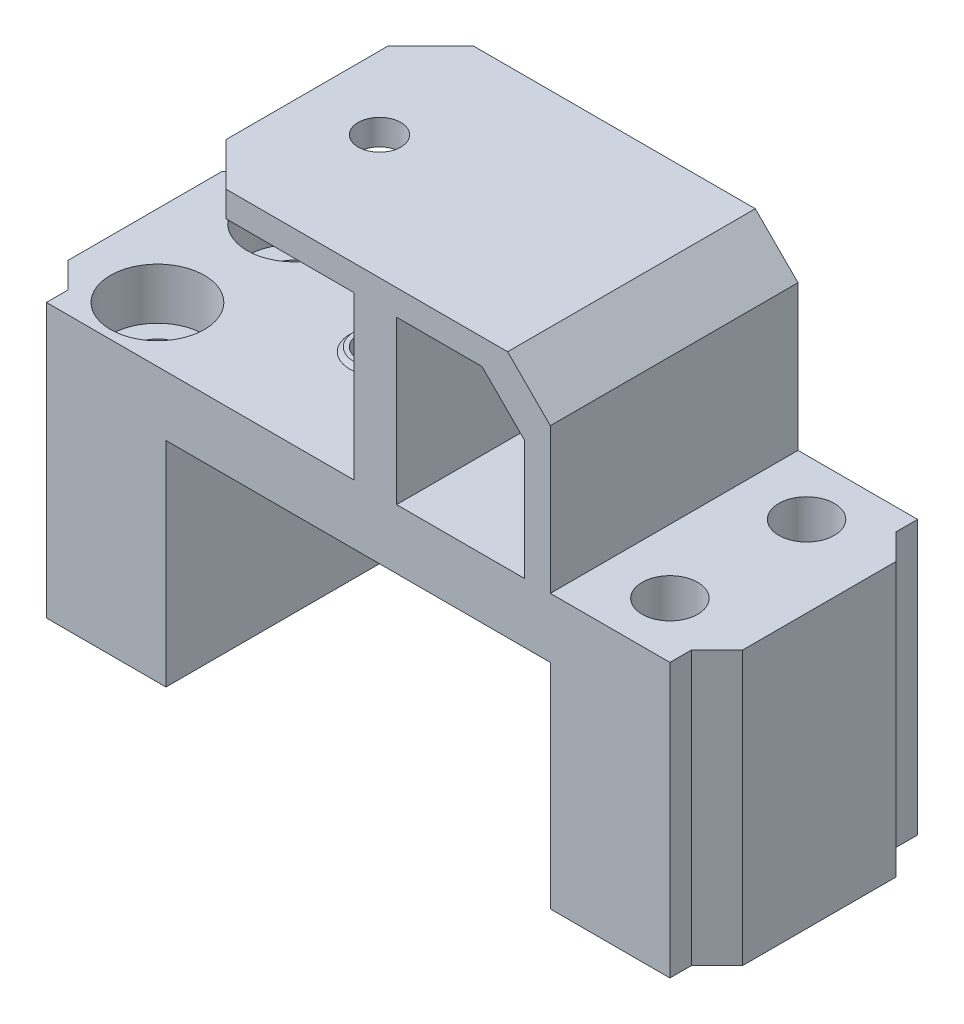
from build123d import *
from build123d.topology import SkipClean

# Parameters (mm, degrees)
SKETCH1_W               = 44.05184454
SKETCH1_H               = 18
BOSS_EXTRUDE1_DEPTH     = 1.5
SKETCH2_W               = 3
SKETCH2_H               = 18
BOSS_EXTRUDE2_DEPTH     = 13
SKETCH3_W               = 29
SKETCH3_H               = 3
BOSS_EXTRUDE3_DEPTH     = 14
CHAMFER1_SIZE           = 3
SKETCH4_R               = 3.25
CUT_EXTRUDE1_DEPTH      = 14
BOSS_EXTRUDE4_START     = 20
SKETCH5_R               = 3.25
BOSS_EXTRUDE4_DEPTH     = 20
BOSS_EXTRUDE5_START     = 7
SKETCH6_R               = 3.25
SKETCH6_W               = 22.5
SKETCH6_H               = 29
BOSS_EXTRUDE5_DEPTH     = 7
SKETCH8_R               = 3.25
BOSS_EXTRUDE6_DEPTH     = 23
BOSS_EXTRUDE8_DEPTH     = 29
SKETCH9_R               = 38.719812757
CUT_EXTRUDE2_DEPTH      = 11.5
CUT_EXTRUDE3_DEPTH      = 79.971513852
CUT_EXTRUDE3_DEPTH_BACK = 79.971513852
SKETCH10_R              = 2.5
CUT_EXTRUDE4_DEPTH      = 3
SKETCH12_R              = 3
SKETCH12_R_2            = 2.5
BOSS_EXTRUDE7_DEPTH     = 0.5
CHAMFER2_SIZE           = 0.5
SKETCH17_R              = 5.5
CUT_EXTRUDE5_DEPTH      = 6
CHAMFER3_SIZE           = 5
BOSS_EXTRUDE9_DEPTH     = 29
CHAMFER4_SIZE           = 5
SKETCH20_R              = 3.25
BOSS_EXTRUDE10_DEPTH    = 2


with BuildPart() as part:
    # Sketch1 → Boss-Extrude1 (new body)
    with BuildSketch(Plane(origin=(0, 0, 0), x_dir=(1, 0, 0), z_dir=(0, 1, 0))):
        with Locations((88.52592227, 8)):
            Rectangle(SKETCH1_W, SKETCH1_H)
        with BuildLine():
            Line((99.736944586, 5.75), (95.736944586, 5.75))
            ThreePointArc((95.736944586, 5.75), (93.486944586, 8), (95.736944586, 10.25))
            Line((95.736944586, 10.25), (99.736944586, 10.25))
            ThreePointArc((99.736944586, 10.25), (101.986944586, 8), (99.736944586, 5.75))
        make_face(mode=Mode.SUBTRACT)
    extrude(amount=BOSS_EXTRUDE1_DEPTH)

    # Sketch2 → Boss-Extrude2 (add)
    with BuildSketch(Plane(origin=(0, 1.5, 0), x_dir=(1, 0, 0), z_dir=(0, 1, 0))):
        with Locations((68, 8)):
            Rectangle(SKETCH2_W, SKETCH2_H)
    extrude(amount=BOSS_EXTRUDE2_DEPTH)

    # Sketch3 → Boss-Extrude3 (add)
    with BuildSketch(Plane.ZY.offset(-66.5)):
        with Locations((-8, 13)):
            Rectangle(SKETCH3_W, SKETCH3_H)
    extrude(amount=BOSS_EXTRUDE3_DEPTH)

    # Chamfer1
    chamfer1_edges = [part.edges().sort_by_distance(p)[0] for p in [
        (66.5, 13, 1),
        (66.5, 13, -17),
    ]]
    chamfer(chamfer1_edges, length=CHAMFER1_SIZE - 0.0001)  # a hair under: the kernel refuses the full size

    # Sketch4 → Cut-Extrude1 (cut)
    with BuildSketch(Plane(origin=(0, 14.5, 0), x_dir=(1, 0, 0), z_dir=(0, 1, 0))):
        with Locations(Location((60, 16, 0), (0, 0, 270))):
            Circle(SKETCH4_R)
        with Locations(Location((60, 0, 0), (0, 0, 270))):
            Circle(SKETCH4_R)
    extrude(amount=-CUT_EXTRUDE1_DEPTH, mode=Mode.SUBTRACT)

    # Sketch5 → Boss-Extrude4 (add)
    with SkipClean():  # the faces are left unmerged after this step: merging them gives an invalid solid
        with BuildSketch(Plane(origin=(0, 14.5, 0), x_dir=(1, 0, 0), z_dir=(0, 1, 0)).offset(BOSS_EXTRUDE4_START)):
            Polygon((69.5, -1), (69.5, 17), (66.5, 20), (66.5, 22.5), (52.5, 22.5), (52.5, -6.5), (66.5, -6.5), (66.5, -4), align=None)
            with Locations(Location((60, 16, 0), (0, 0, 270))):
                Circle(SKETCH5_R, mode=Mode.SUBTRACT)
            with Locations(Location((60, 0, 0), (0, 0, 270))):
                Circle(SKETCH5_R, mode=Mode.SUBTRACT)
        extrude(amount=-BOSS_EXTRUDE4_DEPTH)

    # Sketch6 → Boss-Extrude5 (add)
    # profile 1 of 3: a face of its own
    with BuildSketch(Plane(origin=(0, 34.5, 0), x_dir=(1, 0, 0), z_dir=(0, 1, 0)).offset(BOSS_EXTRUDE5_START)):
        Polygon((30, -6.5), (30, 22.5), (7.5, 22.5), (-6.5, 22.5), (-6.5, 20), (-9.5, 17), (-9.5, -1), (-6.5, -4), (-6.5, -6.5), (7.5, -6.5), align=None)
        with Locations(Location((0, 0, 0), (0, 0, 90))):
            Circle(SKETCH6_R, mode=Mode.SUBTRACT)
        with Locations(Location((0, 16, 0), (0, 0, 90))):
            Circle(SKETCH6_R, mode=Mode.SUBTRACT)
    # profile 2 of 3: a face of its own
    with BuildSketch(Plane(origin=(0, 34.5, 0), x_dir=(1, 0, 0), z_dir=(0, 1, 0)).offset(BOSS_EXTRUDE5_START)):
        with Locations((41.25, 8)):
            Rectangle(SKETCH6_W, SKETCH6_H)
    # profile 3 of 3: a face of its own
    with BuildSketch(Plane(origin=(0, 34.5, 0), x_dir=(1, 0, 0), z_dir=(0, 1, 0)).offset(BOSS_EXTRUDE5_START)):
        Polygon((66.5, -6.5), (66.5, -4), (69.5, -1), (69.5, 17), (66.5, 20), (66.5, 22.5), (52.5, 22.5), (52.5, -6.5), align=None)
        with Locations(Location((60, 0, 0), (0, 0, 270))):
            Circle(SKETCH6_R, mode=Mode.SUBTRACT)
        with Locations(Location((60, 16, 0), (0, 0, 270))):
            Circle(SKETCH6_R, mode=Mode.SUBTRACT)
    extrude(amount=-BOSS_EXTRUDE5_DEPTH)

    # Sketch8 → Boss-Extrude6 (add)
    with BuildSketch(Plane.XZ.offset(-34.5)):
        Polygon((7.5, -22.5), (7.5, 6.5), (-6.5, 6.5), (-6.5, 4), (-9.5, 1), (-9.5, -17), (-6.5, -20), (-6.5, -22.5), align=None)
        with Locations(Location((0, -16, 0), (0, 0, 270))):
            Circle(SKETCH8_R, mode=Mode.SUBTRACT)
        with Locations(Location((0, 0, 0), (0, 0, 270))):
            Circle(SKETCH8_R, mode=Mode.SUBTRACT)
    extrude(amount=BOSS_EXTRUDE6_DEPTH)

    # Sketch18 → Boss-Extrude8 (add)
    with BuildSketch(Plane.XY.offset(6.5)):
        Polygon((9.5, 60.5), (29.5, 60.5), (29.5, 41.5), (34.5, 41.5), (34.5, 63.5), (9.5, 63.5), align=None)
    extrude(amount=-BOSS_EXTRUDE8_DEPTH)

    # Sketch9 → Cut-Extrude2 (cut)
    with BuildSketch(Plane(origin=(0, 0, 0), x_dir=(-1, 0, 0), z_dir=(0, -1, 0))):
        with Locations((-87.720791246, 8.661967718)):
            Circle(SKETCH9_R)
    extrude(amount=-CUT_EXTRUDE2_DEPTH, mode=Mode.SUBTRACT)

    # Sketch10 → Cut-Extrude3 (cut, two sides: drawn at the far end of the back side and taken through both)
    with BuildSketch(Plane(origin=(0, 41.5, 0), x_dir=(1, 0, 0), z_dir=(0, 1, 0)).offset(-CUT_EXTRUDE3_DEPTH_BACK)):
        with Locations(Location((18, 8, 0), (0, 0, 270))):
            Circle(SKETCH10_R)
    extrude(amount=CUT_EXTRUDE3_DEPTH + CUT_EXTRUDE3_DEPTH_BACK, mode=Mode.SUBTRACT)

    # Sketch11 → Cut-Extrude4 (cut)
    with BuildSketch(Plane(origin=(0, 34.5, 0), x_dir=(-1, 0, 0), z_dir=(0, -1, 0))):
        Polygon((-18, 3.381197846), (-14, 5.690598923), (-14, 10.309401077), (-18, 12.618802154), (-22, 10.309401077), (-22, 5.690598923), align=None)
    extrude(amount=-CUT_EXTRUDE4_DEPTH, mode=Mode.SUBTRACT)

    # Sketch12 → Boss-Extrude7 (add)
    with BuildSketch(Plane(origin=(0, 41.5, 0), x_dir=(1, 0, 0), z_dir=(0, 1, 0))):
        with Locations(Location((18, 8, 0), (0, 0, 270))):
            Circle(SKETCH12_R)
        with Locations(Location((18, 8, 0), (0, 0, 270))):
            Circle(SKETCH12_R_2, mode=Mode.SUBTRACT)
    extrude(amount=BOSS_EXTRUDE7_DEPTH)

    # Chamfer2
    chamfer2_edges = [part.edges().sort_by_distance(p)[0] for p in [
        (18, 41.5, -11),
    ]]
    chamfer(chamfer2_edges, length=CHAMFER2_SIZE - 0.0001)  # a hair under: the kernel refuses the full size

    # Sketch17 → Cut-Extrude5 (cut)
    with BuildSketch(Plane(origin=(0, 41.5, 0), x_dir=(1, 0, 0), z_dir=(0, 1, 0))):
        with Locations(Location((0, 16, 0), (0, 0, 270))):
            Circle(SKETCH17_R)
        with Locations(Location((0, 0, 0), (0, 0, 270))):
            Circle(SKETCH17_R)
    extrude(amount=-CUT_EXTRUDE5_DEPTH, mode=Mode.SUBTRACT)

    # Chamfer3
    chamfer3_edges = [part.edges().sort_by_distance(p)[0] for p in [
        (9.5, 62, -22.5),
        (9.5, 62, 6.5),
    ]]
    chamfer(chamfer3_edges, length=CHAMFER3_SIZE)

    # Sketch19 → Boss-Extrude9 (add)
    with BuildSketch(Plane.XY.offset(6.5)):
        Polygon((34.5, 63.5), (52.5, 63.5), (52.5, 41.5), (49.5, 41.5), (49.5, 60.5), (29.5, 60.5), align=None)
    extrude(amount=-BOSS_EXTRUDE9_DEPTH)

    # Chamfer4
    chamfer4_edges = [part.edges().sort_by_distance(p)[0] for p in [
        (52.5, 63.5, -8),
        (49.5, 60.5, -8),
    ]]
    chamfer(chamfer4_edges, length=CHAMFER4_SIZE)

    # Sketch20 → Boss-Extrude10 (add)
    # profile 1 of 2: a face of its own
    with SkipClean():  # the faces are left unmerged after this step: merging them gives an invalid solid
        with BuildSketch(Plane.XZ.offset(-11.5)):
            Polygon((66.5, -20), (69.5, -17), (69.5, 1), (66.5, 4), (66.5, 6.5), (52.5, 6.5), (52.5, -22.5), (66.5, -22.5), align=None)
            with Locations(Location((60, 0, 0), (0, 0, 90))):
                Circle(SKETCH20_R, mode=Mode.SUBTRACT)
            with Locations(Location((60, -16, 0), (0, 0, 90))):
                Circle(SKETCH20_R, mode=Mode.SUBTRACT)
        # profile 2 of 2: a face of its own
        with BuildSketch(Plane.XZ.offset(-11.5)):
            Polygon((7.5, -22.5), (7.5, 6.5), (-6.5, 6.5), (-6.5, 4), (-9.5, 1), (-9.5, -17), (-6.5, -20), (-6.5, -22.5), align=None)
            with Locations(Location((0, 0, 0), (0, 0, 270))):
                Circle(SKETCH20_R, mode=Mode.SUBTRACT)
            with Locations(Location((0, -16, 0), (0, 0, 270))):
                Circle(SKETCH20_R, mode=Mode.SUBTRACT)
        extrude(amount=BOSS_EXTRUDE10_DEPTH)


solid = part.part
